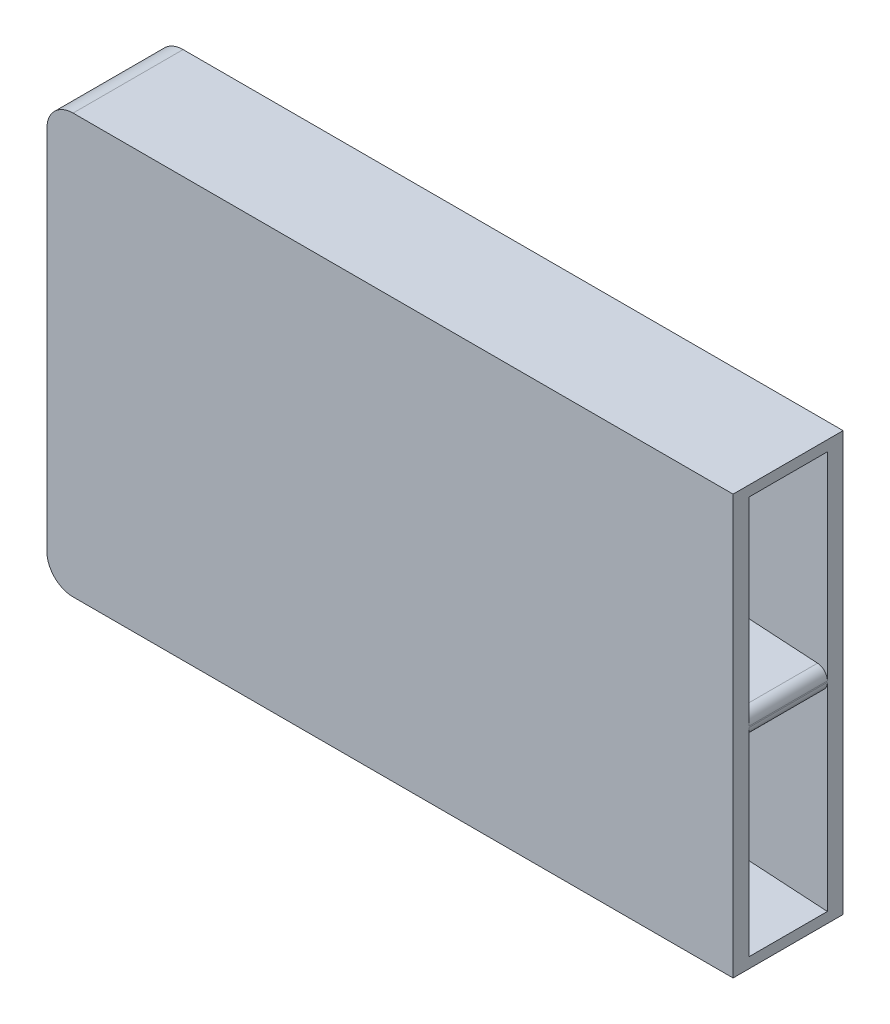
from build123d import *

# Parameters (mm, degrees)
SKETCH1_W           = 65.5
SKETCH1_H           = 40
BOSS_EXTRUDE1_DEPTH = 1.5
BOSS_EXTRUDE2_DEPTH = 7.5
BOSS_EXTRUDE3_START = 7.5
SKETCH1_5_W         = 65.5
SKETCH1_5_H         = 40
BOSS_EXTRUDE3_DEPTH = 1.5
FILLET1_R           = 2.5
FILLET2_R           = 1


with BuildPart() as part:
    # Sketch1 → Boss-Extrude1 (new body)
    with BuildSketch(Plane.XY):
        with Locations((32.75, 20)):
            Rectangle(SKETCH1_W, SKETCH1_H)
    extrude(amount=-BOSS_EXTRUDE1_DEPTH)

    # Sketch1<3> → Boss-Extrude2 (add)
    with BuildSketch(Plane.XY):
        Polygon((0, 5), (0, 0), (65.5, 0), (65.5, 1), align=None)
        Polygon((0, 25), (0, 15), (65.5, 19), (65.5, 21), align=None)
        Polygon((0, 40), (0, 35), (65.5, 39), (65.5, 40), align=None)
    extrude(amount=BOSS_EXTRUDE2_DEPTH)

    # Sketch1<5> → Boss-Extrude3 (add)
    with BuildSketch(Plane.XY.offset(BOSS_EXTRUDE3_START)):
        with Locations((32.75, 20)):
            Rectangle(SKETCH1_5_W, SKETCH1_5_H)
    extrude(amount=BOSS_EXTRUDE3_DEPTH)

    # Fillet1
    fillet1_edges = [part.edges().sort_by_distance(p)[0] for p in [
        (0, 40, 3.75),
        (0, 0, 3.75),
    ]]
    fillet(fillet1_edges, radius=FILLET1_R)

    # Fillet2
    fillet2_edges = [part.edges().sort_by_distance(p)[0] for p in [
        (65.5, 21, 3.75),
        (65.5, 19, 3.75),
    ]]
    fillet(fillet2_edges, radius=FILLET2_R)


solid = part.part
